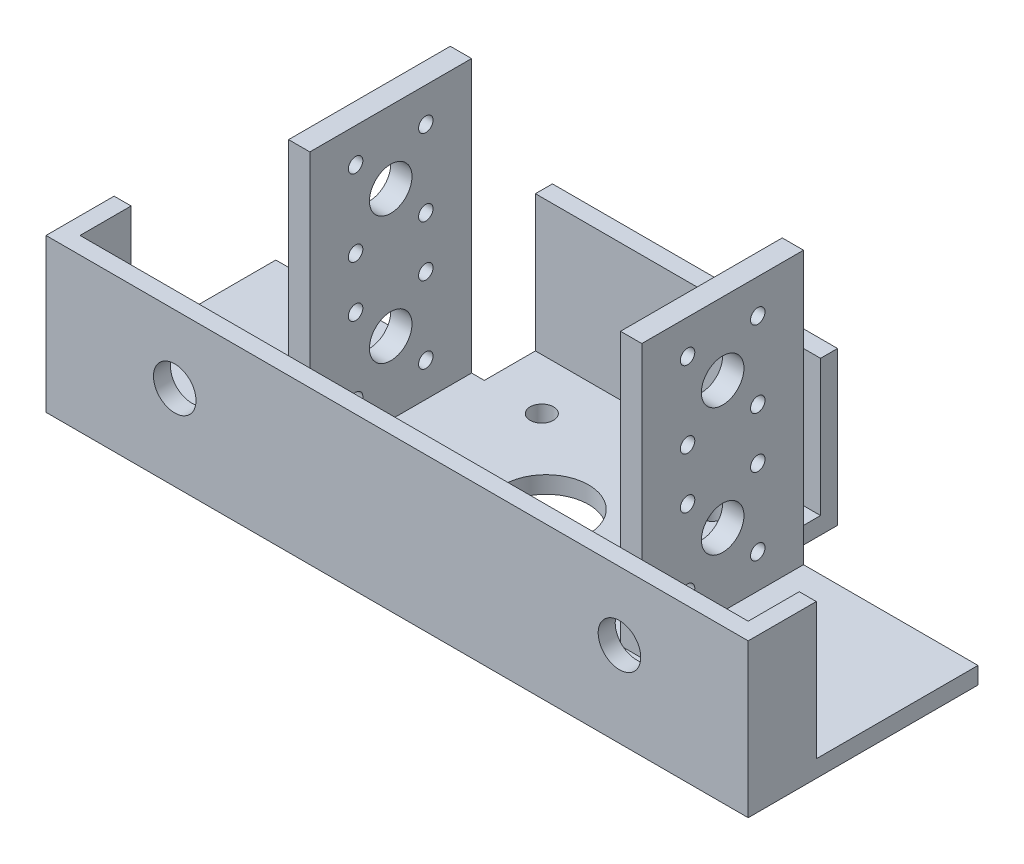
from build123d import *

# Parameters (mm, degrees)
SKETCH1_W                 = 75
SKETCH1_H                 = 40
SKETCH1_R                 = 5
SKETCH1_R_2               = 1.7
SKETCH1_W_2               = 10
SKETCH1_H_2               = 20
BOSS_EXTRUDE1_DEPTH       = 3
CUT_EXTRUDE1_DEPTH        = 43.605750786
CUT_EXTRUDE1_DEPTH_BACK   = 43.605750786
SKETCH2_W                 = 67
SKETCH2_H                 = 28
BOSS_EXTRUDE3_DEPTH       = 110
BOSS_EXTRUDE3_DEPTH_BACK  = 3
SKETCH3_W                 = 75
SKETCH3_H                 = 70
SKETCH3_W_2               = 67
SKETCH3_H_2               = 40
SKETCH6_W                 = 67
SKETCH6_H                 = 11
CUT_EXTRUDE4_DEPTH        = 122.372360939
SKETCH7_W                 = 70
SKETCH7_H                 = 37
BOSS_EXTRUDE4_DEPTH       = 45
SKETCH8_W                 = 45
SKETCH8_H                 = 62
CUT_EXTRUDE6_DEPTH        = 29
SKETCH11_W                = 45
SKETCH11_H                = 4
CUT_EXTRUDE9_DEPTH        = 157.445677473
SKETCH9_W                 = 38
SKETCH9_H                 = 28.5
CUT_EXTRUDE10_DEPTH       = 204.024629048
SKETCH13_W                = 5
SKETCH13_H                = 38
BOSS_EXTRUDE5_DEPTH       = 32
SKETCH14_R                = 5
SKETCH14_R_2              = 1.7
CUT_EXTRUDE11_DEPTH       = 32
SKETCH15_W                = 165
SKETCH15_H                = 70
SKETCH15_W_2              = 157
SKETCH15_H_2              = 62
BOSS_EXTRUDE6_DEPTH       = 3
SKETCH16_W                = 20
SKETCH16_H                = 4.820648258
CUT_EXTRUDE12_DEPTH       = 159.626132778
SKETCH18_R                = 5
CUT_EXTRUDE14_DEPTH       = 159.626132778
MIRROR6_COPY_1_SKETCH_W   = 5
MIRROR6_COPY_1_SKETCH_H   = 38
MIRROR6_COPY_1_DEPTH      = 32
MIRROR6_COPY_2_SKETCH_R   = 5
MIRROR6_COPY_2_SKETCH_R_2 = 1.7
MIRROR6_COPY_2_DEPTH      = 32
MIRROR6_COPY_3_SKETCH_W   = 5
MIRROR6_COPY_3_SKETCH_H   = 38
MIRROR6_COPY_3_DEPTH      = 32
MIRROR6_COPY_4_SKETCH_R   = 5
MIRROR6_COPY_4_SKETCH_R_2 = 1.7
MIRROR6_COPY_4_DEPTH      = 32
SKETCH19_W                = 38
SKETCH19_H                = 3.5
CUT_EXTRUDE15_DEPTH       = 10
SKETCH20_R                = 1.2
CUT_EXTRUDE16_DEPTH       = 10
SKETCH21_W                = 10
SKETCH21_H                = 80
CUT_EXTRUDE17_DEPTH       = 184.330984833
SKETCH22_W                = 55
SKETCH22_H                = 80
CUT_EXTRUDE18_DEPTH       = 184.330984833
SKETCH23_W                = 67
SKETCH23_H                = 62
BOSS_EXTRUDE7_DEPTH       = 4
SKETCH24_R                = 10
SKETCH24_R_2              = 2.75
CUT_EXTRUDE19_DEPTH       = 111.123793978
CUT_EXTRUDE21_START       = -16
SKETCH25_R                = 5
CUT_EXTRUDE21_DEPTH       = 16


with BuildPart() as part:
    # Sketch1 → Boss-Extrude1 (new body)
    with BuildSketch(Plane(origin=(0, 0, 0), x_dir=(1, 0, 0), z_dir=(0, 1, 0))):
        Rectangle(SKETCH1_W, SKETCH1_H)
        with Locations((-21, 0)):
            Circle(SKETCH1_R, mode=Mode.SUBTRACT)
        with Locations((-30, 8.25)):
            Circle(SKETCH1_R_2, mode=Mode.SUBTRACT)
        with Locations((-12, 8.25)):
            Circle(SKETCH1_R_2, mode=Mode.SUBTRACT)
        with Locations((-12, -8.25)):
            Circle(SKETCH1_R_2, mode=Mode.SUBTRACT)
        with Locations((-30, -8.25)):
            Circle(SKETCH1_R_2, mode=Mode.SUBTRACT)
        with Locations((12, 8.25)):
            Circle(SKETCH1_R_2, mode=Mode.SUBTRACT)
        with Locations((12, -8.25)):
            Circle(SKETCH1_R_2, mode=Mode.SUBTRACT)
        with Locations((21, 0)):
            Circle(SKETCH1_R, mode=Mode.SUBTRACT)
        with Locations((30, -8.25)):
            Circle(SKETCH1_R_2, mode=Mode.SUBTRACT)
        with Locations((30, 8.25)):
            Circle(SKETCH1_R_2, mode=Mode.SUBTRACT)
        Rectangle(SKETCH1_W_2, SKETCH1_H_2, mode=Mode.SUBTRACT)
    extrude(amount=BOSS_EXTRUDE1_DEPTH)

    # Sketch2 → Cut-Extrude1 (cut, two sides: drawn at the far end of the back side and taken through both)
    with BuildSketch(Plane(origin=(0, 3, 0), x_dir=(1, 0, 0), z_dir=(0, 1, 0)).offset(-CUT_EXTRUDE1_DEPTH_BACK)):
        Rectangle(SKETCH2_W, SKETCH2_H)
    extrude(amount=CUT_EXTRUDE1_DEPTH + CUT_EXTRUDE1_DEPTH_BACK, mode=Mode.SUBTRACT)

    # Sketch3 → Boss-Extrude3 (add, two sides: drawn at the far end of the back side and taken through both)
    with BuildSketch(Plane(origin=(0, 3, 0), x_dir=(1, 0, 0), z_dir=(0, 1, 0)).offset(-BOSS_EXTRUDE3_DEPTH_BACK)):
        Rectangle(SKETCH3_W, SKETCH3_H)
        Rectangle(SKETCH3_W_2, SKETCH3_H_2, mode=Mode.SUBTRACT)
    extrude(amount=BOSS_EXTRUDE3_DEPTH + BOSS_EXTRUDE3_DEPTH_BACK)

    # Sketch6 → Cut-Extrude4 (cut, through all)
    with BuildSketch(Plane(origin=(0, 3, 0), x_dir=(1, 0, 0), z_dir=(0, 1, 0))):
        with Locations((0, -25.5)):
            Rectangle(SKETCH6_W, SKETCH6_H)
        with Locations((0, 25.5)):
            Rectangle(SKETCH6_W, SKETCH6_H)
    extrude(amount=CUT_EXTRUDE4_DEPTH, mode=Mode.SUBTRACT)

    # Sketch7 → Boss-Extrude4 (add)
    with BuildSketch(Plane.ZY.offset(37.5)):
        with Locations((0, 94.5)):
            Rectangle(SKETCH7_W, SKETCH7_H)
    boss_extrude4 = extrude(amount=BOSS_EXTRUDE4_DEPTH)

    # Mirror2: Boss-Extrude4 across plane
    add(boss_extrude4.mirror(Plane(origin=(0, 0, 0), x_dir=(0, 0, 1), z_dir=(1, 0, 0))))

    # Sketch8 → Cut-Extrude6 (cut)
    with BuildSketch(Plane(origin=(0, 113, 0), x_dir=(1, 0, 0), z_dir=(0, 1, 0))):
        with Locations((-56, 0)):
            Rectangle(SKETCH8_W, SKETCH8_H)
        with Locations((56, 0)):
            Rectangle(SKETCH8_W, SKETCH8_H)
    extrude(amount=-CUT_EXTRUDE6_DEPTH, mode=Mode.SUBTRACT)

    # Sketch11 → Cut-Extrude9 (cut, through all)
    with BuildSketch(Plane.XY.offset(35)):
        with Locations((-60, 78)):
            Rectangle(SKETCH11_W, SKETCH11_H)
        with Locations((60, 78)):
            Rectangle(SKETCH11_W, SKETCH11_H)
    extrude(amount=-CUT_EXTRUDE9_DEPTH, mode=Mode.SUBTRACT)

    # Sketch9 → Cut-Extrude10 (cut, through all)
    with BuildSketch(Plane.ZY.offset(82.5)):
        with Locations((0, 98.25)):
            Rectangle(SKETCH9_W, SKETCH9_H)
    extrude(amount=-CUT_EXTRUDE10_DEPTH, mode=Mode.SUBTRACT)

    # Sketch13 → Boss-Extrude5 (add)
    with BuildSketch(Plane(origin=(0, 84, 0), x_dir=(1, 0, 0), z_dir=(0, 1, 0))):
        with Locations((-39, 0)):
            Rectangle(SKETCH13_W, SKETCH13_H)
    boss_extrude5 = extrude(amount=BOSS_EXTRUDE5_DEPTH)

    # Sketch14 → Cut-Extrude11 (cut)
    with BuildSketch(Plane.ZY.offset(41.5)):
        with Locations((0, 101)):
            Circle(SKETCH14_R)
        with Locations((-8.25, 110)):
            Circle(SKETCH14_R_2)
        with Locations((8.25, 110)):
            Circle(SKETCH14_R_2)
        with Locations((8.25, 92)):
            Circle(SKETCH14_R_2)
        with Locations((-8.25, 92)):
            Circle(SKETCH14_R_2)
    cut_extrude11 = extrude(amount=-CUT_EXTRUDE11_DEPTH, mode=Mode.SUBTRACT)

    # Mirror4: Boss-Extrude5, Cut-Extrude11 across plane
    add(boss_extrude5.mirror(Plane(origin=(0, 0, 0), x_dir=(0, 0, 1), z_dir=(1, 0, 0))))
    add(cut_extrude11.mirror(Plane(origin=(0, 0, 0), x_dir=(0, 0, 1), z_dir=(1, 0, 0))), mode=Mode.SUBTRACT)

    # Sketch15 → Boss-Extrude6 (add)
    with BuildSketch(Plane(origin=(0, 113, 0), x_dir=(1, 0, 0), z_dir=(0, 1, 0))):
        Rectangle(SKETCH15_W, SKETCH15_H)
        Rectangle(SKETCH15_W_2, SKETCH15_H_2, mode=Mode.SUBTRACT)
    extrude(amount=BOSS_EXTRUDE6_DEPTH)

    # Sketch16 → Cut-Extrude12 (cut, through all)
    with BuildSketch(Plane.XY.offset(35)):
        with Locations((0, 11.636111214)):
            Rectangle(SKETCH16_W, SKETCH16_H)
    extrude(amount=-CUT_EXTRUDE12_DEPTH, mode=Mode.SUBTRACT)

    # Sketch18 → Cut-Extrude14 (cut, through all)
    with BuildSketch(Plane.XY.offset(35)):
        with Locations((52.25, 100)):
            Circle(SKETCH18_R)
    cut_extrude14 = extrude(amount=-CUT_EXTRUDE14_DEPTH, mode=Mode.SUBTRACT)

    # Mirror5: Cut-Extrude14 across plane
    add(cut_extrude14.mirror(Plane(origin=(0, 0, 0), x_dir=(0, 0, 1), z_dir=(1, 0, 0))), mode=Mode.SUBTRACT)

    # Mirror6 copy 1 sketch → Mirror6 copy 1 (add)
    with BuildSketch(Plane(origin=(0, 148, 0), x_dir=(-1, 0, 0), z_dir=(0, -1, 0))):
        with Locations((-39, 0)):
            Rectangle(MIRROR6_COPY_1_SKETCH_W, MIRROR6_COPY_1_SKETCH_H)
    extrude(amount=MIRROR6_COPY_1_DEPTH)

    # Mirror6 copy 2 sketch → Mirror6 copy 2 (cut)
    with BuildSketch(Plane(origin=(41.5, 232, 0), x_dir=(0, 0, 1), z_dir=(1, 0, 0))):
        with Locations((0, 101)):
            Circle(MIRROR6_COPY_2_SKETCH_R)
        with Locations((-8.25, 110)):
            Circle(MIRROR6_COPY_2_SKETCH_R_2)
        with Locations((8.25, 110)):
            Circle(MIRROR6_COPY_2_SKETCH_R_2)
        with Locations((8.25, 92)):
            Circle(MIRROR6_COPY_2_SKETCH_R_2)
        with Locations((-8.25, 92)):
            Circle(MIRROR6_COPY_2_SKETCH_R_2)
    extrude(amount=-MIRROR6_COPY_2_DEPTH, mode=Mode.SUBTRACT)

    # Mirror6 copy 3 sketch → Mirror6 copy 3 (add)
    with BuildSketch(Plane.XZ.offset(-148)):
        with Locations((-39, 0)):
            Rectangle(MIRROR6_COPY_3_SKETCH_W, MIRROR6_COPY_3_SKETCH_H)
    extrude(amount=MIRROR6_COPY_3_DEPTH)

    # Mirror6 copy 4 sketch → Mirror6 copy 4 (cut)
    with BuildSketch(Plane(origin=(-41.5, 232, 0), x_dir=(0, 0, 1), z_dir=(-1, 0, 0))):
        with Locations((0, -101)):
            Circle(MIRROR6_COPY_4_SKETCH_R)
        with Locations((-8.25, -110)):
            Circle(MIRROR6_COPY_4_SKETCH_R_2)
        with Locations((8.25, -110)):
            Circle(MIRROR6_COPY_4_SKETCH_R_2)
        with Locations((8.25, -92)):
            Circle(MIRROR6_COPY_4_SKETCH_R_2)
        with Locations((-8.25, -92)):
            Circle(MIRROR6_COPY_4_SKETCH_R_2)
    extrude(amount=-MIRROR6_COPY_4_DEPTH, mode=Mode.SUBTRACT)

    # Sketch19 → Cut-Extrude15 (cut)
    with BuildSketch(Plane(origin=(82.5, 0, 0), x_dir=(0, 0, -1), z_dir=(1, 0, 0))):
        with Locations((0, 114.25)):
            Rectangle(SKETCH19_W, SKETCH19_H)
    cut_extrude15 = extrude(amount=-CUT_EXTRUDE15_DEPTH, mode=Mode.SUBTRACT)

    # Mirror7: Cut-Extrude15 across plane
    add(cut_extrude15.mirror(Plane(origin=(0, 0, 0), x_dir=(0, 0, 1), z_dir=(1, 0, 0))), mode=Mode.SUBTRACT)

    # Sketch20 → Cut-Extrude16 (cut)
    with BuildSketch(Plane(origin=(0, 3, 0), x_dir=(1, 0, 0), z_dir=(0, 1, 0))):
        with Locations((-12, 17.5)):
            Circle(SKETCH20_R)
        with Locations((-12, -17.5)):
            Circle(SKETCH20_R)
        with Locations((-24, -17.5)):
            Circle(SKETCH20_R)
        with Locations((-24, 17.5)):
            Circle(SKETCH20_R)
        with Locations((12, -17.5)):
            Circle(SKETCH20_R)
        with Locations((24, -17.5)):
            Circle(SKETCH20_R)
        with Locations((12, 17.5)):
            Circle(SKETCH20_R)
        with Locations((24, 17.5)):
            Circle(SKETCH20_R)
    extrude(amount=-CUT_EXTRUDE16_DEPTH, mode=Mode.SUBTRACT)

    # Sketch21 → Cut-Extrude17 (cut, through all)
    with BuildSketch(Plane.XY.offset(35)):
        with Locations((32.5, 40)):
            Rectangle(SKETCH21_W, SKETCH21_H)
        with Locations((-32.5, 40)):
            Rectangle(SKETCH21_W, SKETCH21_H)
    extrude(amount=-CUT_EXTRUDE17_DEPTH, mode=Mode.SUBTRACT)

    # Sketch22 → Cut-Extrude18 (cut, through all)
    with BuildSketch(Plane.XY.offset(35)):
        with Locations((0, 40)):
            Rectangle(SKETCH22_W, SKETCH22_H)
    extrude(amount=-CUT_EXTRUDE18_DEPTH, mode=Mode.SUBTRACT)

    # Sketch23 → Boss-Extrude7 (add)
    with BuildSketch(Plane.XZ.offset(-80)):
        Rectangle(SKETCH23_W, SKETCH23_H)
    extrude(amount=-BOSS_EXTRUDE7_DEPTH)

    # Sketch24 → Cut-Extrude19 (cut, through all)
    with BuildSketch(Plane(origin=(0, 84, 0), x_dir=(1, 0, 0), z_dir=(0, 1, 0))):
        Circle(SKETCH24_R)
        with Locations((-20, 19)):
            Circle(SKETCH24_R_2)
        with Locations((-20, -19)):
            Circle(SKETCH24_R_2)
        with Locations((20, -19)):
            Circle(SKETCH24_R_2)
        with Locations((20, 19)):
            Circle(SKETCH24_R_2)
    extrude(amount=-CUT_EXTRUDE19_DEPTH, mode=Mode.SUBTRACT)

    # Sketch25 → Cut-Extrude21 (cut)
    with BuildSketch(Plane(origin=(0, 0, -35), x_dir=(-1, 0, 0), z_dir=(0, 0, -1)).offset(CUT_EXTRUDE21_START)):
        Polygon((33.5, 116), (33.5, 84), (33.5, 80), (82.5, 80), (82.5, 116), align=None)
        with Locations((52.25, 100)):
            Circle(SKETCH25_R, mode=Mode.SUBTRACT)
    cut_extrude21 = extrude(amount=CUT_EXTRUDE21_DEPTH, mode=Mode.SUBTRACT)

    # Mirror8: Cut-Extrude21 across plane
    add(cut_extrude21.mirror(Plane(origin=(0, 0, 0), x_dir=(0, 0, 1), z_dir=(1, 0, 0))), mode=Mode.SUBTRACT)


solid = part.part
